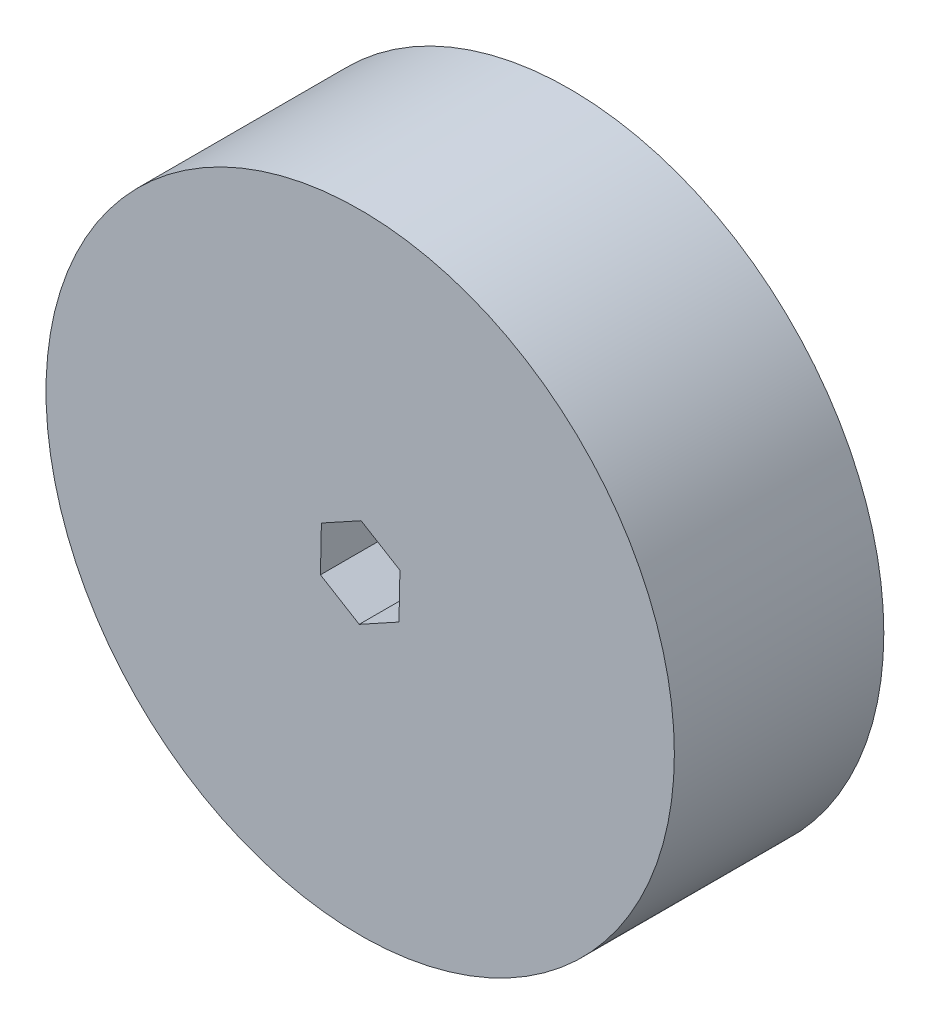
from build123d import *

# Parameters (mm, degrees)
SKETCH1_R           = 38.1
BOSS_EXTRUDE1_DEPTH = 25.4


with BuildPart() as part:
    # Sketch1 → Boss-Extrude1 (new body)
    with BuildSketch(Plane.XY):
        Circle(SKETCH1_R)
        Polygon((4.818540249, 2.650197137), (0.114132079, 5.498076834), (-4.70440817, 2.847879697), (-4.818540249, -2.650197137), (-0.114132079, -5.498076834), (4.70440817, -2.847879697), align=None, mode=Mode.SUBTRACT)
    extrude(amount=BOSS_EXTRUDE1_DEPTH)


solid = part.part
